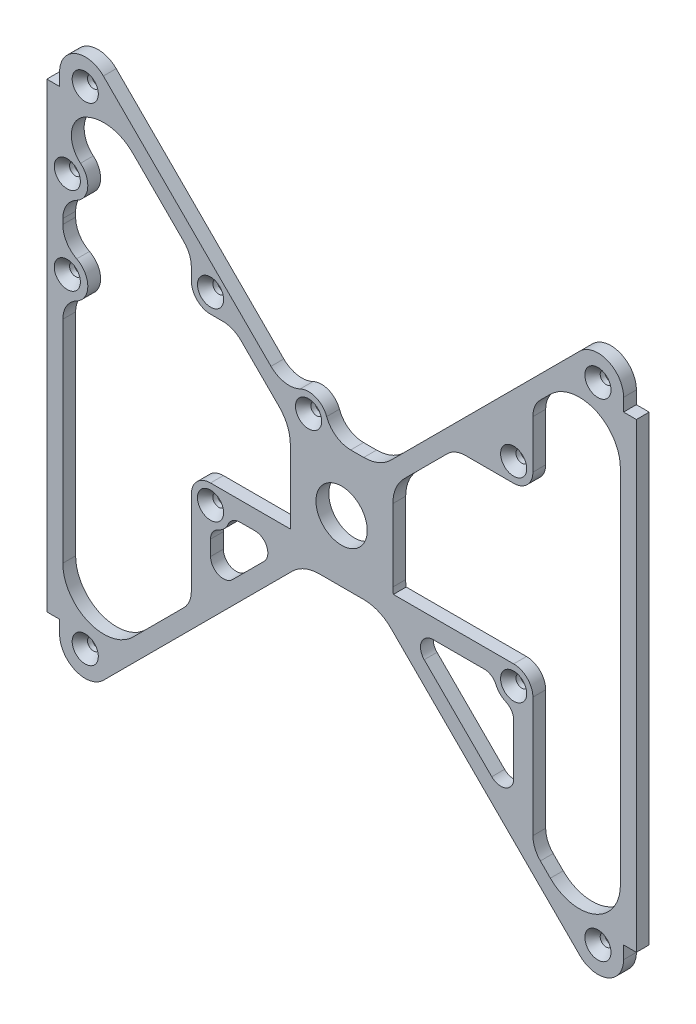
from build123d import *

# Parameters (mm, degrees)
BOSS_EXTRUDE1_DEPTH           = 3.175
MIRROR2_COPY_1_DEPTH          = 3.175
INTERNAL_SHARPS_R             = 9.525
IMU_MOUNTING_DEPTH            = 3.175
IMU_MOUNTING_HOLES_AT_2_COUNT = 2
IMU_MOUNTING_HOLES_AT_2_PITCH = 21.59
IMU_TOOLING_RADIUS_R          = 6.35
SKETCH18_R                    = 4.7625
MCU_MOUNTING_RIBS_DEPTH       = 3.175
TOOLING_RADIUS_R              = 6.35
TOOLING_RADIUS_SMALL_R        = 3.175
SKETCH6_R                     = 6.35
MATERIAL_REMOVAL_DEPTH        = 99.935771608
MCU_MOUNTING_HOLES_AT_2_COUNT = 2
MCU_MOUNTING_HOLES_AT_2_PITCH = 45.72
MCU_MOUNTING_HOLES_AT_3_COUNT = 2
MCU_MOUNTING_HOLES_AT_3_PITCH = 88.57441442
MCU_MOUNTING_HOLES_AT_4_COUNT = 2
MCU_MOUNTING_HOLES_AT_4_PITCH = 75.093140098
MCU_MOUNTING_HOLES_AT_5_COUNT = 2
MCU_MOUNTING_HOLES_AT_5_PITCH = 39.97120776


with BuildPart() as part:
    # Sketch1 → Boss-Extrude1 (new body)
    with BuildSketch(Plane.XY):
        with BuildLine():
            Line((9.434743879, 15.24), (0, 15.24))
            Line((0, 15.24), (0, 0))
            Line((0, 0), (12.7, 0))
            Line((12.7, 0), (12.7, 12.892596045))
            Line((12.7, 12.892596045), (51.712045103, 51.904641149))
            ThreePointArc((51.712045103, 51.904641149), (62.784313673, 54.107052302), (69.05625, 44.720436252))
            Line((69.05625, 44.720436252), (69.05625, 0))
            Line((69.05625, 0), (73.025, 0))
            Line((73.025, 0), (73.025, 57.15))
            Line((73.025, 57.15), (69.85, 57.15))
            Line((69.85, 57.15), (69.85, 60.325))
            ThreePointArc((69.85, 60.325), (65.930039796, 66.191635031), (59.009871939, 64.815128061))
            Line((59.009871939, 64.815128061), (9.434743879, 15.24))
        make_face()
    boss_extrude1 = extrude(amount=BOSS_EXTRUDE1_DEPTH)

    # Sketch11 → CSK for #4 Flat Head Machine Screw1 (revolve, cut)
    with BuildSketch(Plane(origin=(63.5, 60.325, 3.175), x_dir=(0, -1, 0), z_dir=(1, 0, 0))):
        Polygon((0, 0), (0, 3.175), (1.4732, 3.175), (1.4732, 2.030745349), (3.2385, 0), align=None)
    csk_for_4_flat_head_machine_screw1 = revolve(axis=Axis((63.5, 60.325, 9.525), (0, 0, -1)), mode=Mode.SUBTRACT)

    # Mirror1: Boss-Extrude1, CSK for #4 Flat Head Machine Screw1 across plane
    add(boss_extrude1.mirror(Plane.ZX))
    add(csk_for_4_flat_head_machine_screw1.mirror(Plane.ZX), mode=Mode.SUBTRACT)

    # Mirror2: Boss-Extrude1, CSK for #4 Flat Head Machine Screw1 across plane
    add(boss_extrude1.mirror(Plane(origin=(0, 0, 0), x_dir=(0, 0, 1), z_dir=(1, 0, 0))))
    add(csk_for_4_flat_head_machine_screw1.mirror(Plane(origin=(0, 0, 0), x_dir=(0, 0, 1), z_dir=(1, 0, 0))), mode=Mode.SUBTRACT)

    # Mirror2 copy 1 sketch → Mirror2 copy 1 (add)
    with BuildSketch(Plane(origin=(0, 0, 0), x_dir=(-1, 0, 0), z_dir=(0, 0, 1))):
        with BuildLine():
            Line((9.434743879, 15.24), (0, 15.24))
            Line((0, 15.24), (0, 0))
            Line((0, 0), (12.7, 0))
            Line((12.7, 0), (12.7, 12.892596045))
            Line((12.7, 12.892596045), (51.712045103, 51.904641149))
            ThreePointArc((51.712045103, 51.904641149), (62.784313673, 54.107052302), (69.05625, 44.720436252))
            Line((69.05625, 44.720436252), (69.05625, 0))
            Line((69.05625, 0), (73.025, 0))
            Line((73.025, 0), (73.025, 57.15))
            Line((73.025, 57.15), (69.85, 57.15))
            Line((69.85, 57.15), (69.85, 60.325))
            ThreePointArc((69.85, 60.325), (65.930039796, 66.191635031), (59.009871939, 64.815128061))
            Line((59.009871939, 64.815128061), (9.434743879, 15.24))
        make_face()
    extrude(amount=MIRROR2_COPY_1_DEPTH)

    # Mirror2 copy 2 sketch → Mirror2 copy 2 (revolve, cut)
    with BuildSketch(Plane(origin=(-63.5, -60.325, 3.175), x_dir=(0, 1, 0), z_dir=(-1, 0, 0))):
        Polygon((0, 0), (0, 3.175), (1.4732, 3.175), (1.4732, 2.030745349), (3.2385, 0), align=None)
    revolve(axis=Axis((-63.5, -60.325, 9.525), (0, 0, -1)), mode=Mode.SUBTRACT)

    # INTERNAL-SHARPS
    internal_sharps_edges = [part.edges().sort_by_distance(p)[0] for p in [
        (-9.434743879, 15.24, 1.5875),
        (-12.7, 12.892596045, 1.5875),
        (9.434743879, 15.24, 1.5875),
        (12.7, 12.892596045, 1.5875),
        (9.434743879, -15.24, 1.5875),
        (12.7, -12.892596045, 1.5875),
        (-12.7, -12.892596045, 1.5875),
        (-9.434743879, -15.24, 1.5875),
    ]]
    fillet(internal_sharps_edges, radius=INTERNAL_SHARPS_R)

    # Sketch13 → IMU-MOUNTING (add)
    with BuildSketch(Plane.XY):
        with BuildLine():
            Line((-73.025, 44.45), (-73.025, 12.7))
            Line((-73.025, 12.7), (-67.945, 12.7))
            ThreePointArc((-67.945, 12.7), (-62.895851895, 18.339020045), (-69.05625, 22.736967161))
            Line((-69.05625, 22.736967161), (-69.05625, 34.413032839))
            ThreePointArc((-69.05625, 34.413032839), (-62.895851895, 38.810979955), (-67.945, 44.45))
            Line((-67.945, 44.45), (-73.025, 44.45))
        make_face()
    extrude(amount=IMU_MOUNTING_DEPTH)

    # Sketch15 → IMU-MOUNTING-HOLES (revolve, cut)
    with BuildSketch(Plane(origin=(-67.945, 17.78, 3.175), x_dir=(0, -1, 0), z_dir=(1, 0, 0))):
        Polygon((0, 0), (0, 3.175), (1.4732, 3.175), (1.4732, 2.030745349), (3.2385, 0), align=None)
    imu_mounting_holes = revolve(axis=Axis((-67.945, 17.78, 9.525), (0, 0, -1)), mode=Mode.SUBTRACT)

    # IMU-MOUNTING-HOLES at 2: IMU-MOUNTING-HOLES ×2
    with Locations(*[(0, i * IMU_MOUNTING_HOLES_AT_2_PITCH, 0) for i in range(1, IMU_MOUNTING_HOLES_AT_2_COUNT)]):
        add(imu_mounting_holes, mode=Mode.SUBTRACT)

    # IMU-TOOLING-RADIUS
    imu_tooling_radius_edges = [part.edges().sort_by_distance(p)[0] for p in [
        (-69.05625, 44.45, 1.5875),
        (-69.05625, 12.7, 1.5875),
        (-69.05625, 22.736967161, 1.5875),
        (-69.05625, 34.413032839, 1.5875),
    ]]
    fillet(imu_tooling_radius_edges, radius=IMU_TOOLING_RADIUS_R)

    # Sketch18 → MCU-MOUNTING-RIBS (add)
    with BuildSketch(Plane(origin=(0, 0, 0), x_dir=(-1, 0, 0), z_dir=(0, 0, -1))):
        with Locations((8.1788, 17.78)):
            Circle(SKETCH18_R)
        with BuildLine():
            Line((32.4612, -32.653796045), (37.2237, -37.416296045))
            Line((37.2237, -37.416296045), (37.2237, -13.97))
            ThreePointArc((37.2237, -13.97), (35.828796045, -10.602403955), (32.4612, -9.2075))
            Line((32.4612, -9.2075), (9.014903955, -9.2075))
            Line((9.014903955, -9.2075), (13.777403955, -13.97))
            Line((13.777403955, -13.97), (27.6987, -13.97))
            ThreePointArc((27.6987, -13.97), (29.093603955, -17.337596045), (32.4612, -18.7325))
            Line((32.4612, -18.7325), (32.4612, -32.653796045))
        make_face()
        with BuildLine():
            Line((32.4612, 26.9875), (26.794903955, 26.9875))
            Line((26.794903955, 26.9875), (37.2237, 37.416296045))
            Line((37.2237, 37.416296045), (37.2237, 31.75))
            ThreePointArc((37.2237, 31.75), (35.828796045, 28.382403955), (32.4612, 26.9875))
        make_face()
        with BuildLine():
            Line((-42.6212, -10.4775), (-10.284903955, -10.4775))
            Line((-10.284903955, -10.4775), (-15.047403955, -15.24))
            Line((-15.047403955, -15.24), (-37.8587, -15.24))
            ThreePointArc((-37.8587, -15.24), (-39.253603955, -18.607596045), (-42.6212, -20.0025))
            Line((-42.6212, -20.0025), (-42.6212, -42.813796045))
            Line((-42.6212, -42.813796045), (-47.3837, -47.576296045))
            Line((-47.3837, -47.576296045), (-47.3837, -15.24))
            ThreePointArc((-47.3837, -15.24), (-45.988796045, -11.872403955), (-42.6212, -10.4775))
        make_face()
        with BuildLine():
            Line((-42.6212, 28.2575), (-28.064903955, 28.2575))
            Line((-28.064903955, 28.2575), (-47.3837, 47.576296045))
            Line((-47.3837, 47.576296045), (-47.3837, 33.02))
            ThreePointArc((-47.3837, 33.02), (-45.988796045, 29.652403955), (-42.6212, 28.2575))
        make_face()
    extrude(amount=-MCU_MOUNTING_RIBS_DEPTH)

    # TOOLING-RADIUS
    tooling_radius_edges = [part.edges().sort_by_distance(p)[0] for p in [
        (-37.2237, -37.416296045, 1.5875),
        (47.3837, -47.576296045, 1.5875),
        (-26.794903955, 26.9875, 1.5875),
        (-37.2237, 37.416296045, 1.5875),
        (28.064903955, 28.2575, 1.5875),
        (47.3837, 47.576296045, 1.5875),
        (-12.858570933, 18.663827054, 1.5875),
        (-4.150176631, 15.24, 1.5875),
    ]]
    fillet(tooling_radius_edges, radius=TOOLING_RADIUS_R)

    # TOOLING-RADIUS-SMALL
    # the kernel refuses this fillet: 3.175 mm, written as the material it adds along each edge
    with BuildSketch(Plane(origin=(42.6212, -20.0025, 0), x_dir=(-0.9789063129307034, 0.2043096436892193, 0), z_dir=(0, 0, 1)), Plane(origin=(-27.6987, -13.97, 0), x_dir=(-0.2043096436892193, -0.9789063129307034, 0), z_dir=(0, 0, 1))) as tooling_radius_small_piece_1:
        with BuildLine():
            CenterArc((2.594732475, 3.108027544), TOOLING_RADIUS_SMALL_R, 191.789089239, 66.421821522)
            Line((-0.513295069, 2.459344425), (0, 0))
            ThreePointArc((0, 0), (0.973024678, 0.100458685), (1.946049356, 0))
        make_face()
    extrude(amount=3.175)
    with BuildSketch(Plane(origin=(37.8587, -15.24, 0), x_dir=(-1, 0, 0), z_dir=(0, 0, 1)), Plane(origin=(-32.4612, -18.7325, 0), x_dir=(0, -1, 0), z_dir=(0, 0, 1))) as tooling_radius_small_piece_2:
        with BuildLine():
            CenterArc((2.512338916, 3.175), TOOLING_RADIUS_SMALL_R, 203.578178478, 66.421821522)
            ThreePointArc((-0.397596651, 1.905), (-0.100458685, 0.973024678), (0, 0))
            Line((0, 0), (2.512338916, 0))
        make_face()
    extrude(amount=3.175)
    with BuildSketch(Plane(origin=(42.6212, -42.813796045, 0), x_dir=(0, 1, 0), z_dir=(0, 0, 1))) as tooling_radius_small_piece_3:
        with BuildLine():
            CenterArc((TOOLING_RADIUS_SMALL_R * 2.41421356237, TOOLING_RADIUS_SMALL_R), TOOLING_RADIUS_SMALL_R, 135, 135)
            Line((TOOLING_RADIUS_SMALL_R * 1.70710678119, TOOLING_RADIUS_SMALL_R * 1.70710678119), (0, 0))
            Line((0, 0), (TOOLING_RADIUS_SMALL_R * 2.41421356237, 0))
        make_face()
    extrude(amount=3.175)
    with BuildSketch(Plane(origin=(-32.4612, -32.653796045, 0), x_dir=(0, 1, 0), z_dir=(0, 0, 1))) as tooling_radius_small_piece_4:
        with BuildLine():
            CenterArc((TOOLING_RADIUS_SMALL_R * 2.41421356237, -TOOLING_RADIUS_SMALL_R), TOOLING_RADIUS_SMALL_R, 90, 135)
            Line((TOOLING_RADIUS_SMALL_R * 1.70710678119, -TOOLING_RADIUS_SMALL_R * 1.70710678119), (0, 0))
            Line((0, 0), (TOOLING_RADIUS_SMALL_R * 2.41421356237, 0))
        make_face()
    extrude(amount=3.175)
    with BuildSketch(Plane(origin=(-14.131964455, -13.97, 0), x_dir=(-1, 0, 0), z_dir=(0, 0, 1))) as tooling_radius_small_piece_5:
        with BuildLine():
            CenterArc((7.310567561, 3.175), TOOLING_RADIUS_SMALL_R, 135, 135)
            Line((5.06550353, 5.42006403), (4.840997127, 5.644570433))
            ThreePointArc((4.840997127, 5.644570433), (1.133337052, 1.936910358), (-0.269767852, 0.167426271))
            Line((-0.269767852, 0.167426271), (0, -0.3175))
            Line((0, -0.3175), (7.310567561, -0.3175))
            Line((7.310567561, -0.3175), (7.310567561, 0))
        make_face()
    extrude(amount=3.175)
    with BuildSketch(Plane(origin=(15.074724308, -15.24, 0), x_dir=(0.7053179071572191, -0.7088911410388483, 0), z_dir=(0, 0, 1))) as tooling_radius_small_piece_6:
        with BuildLine():
            CenterArc((7.63781192, 3.174989865), TOOLING_RADIUS_SMALL_R, 135.144766988, 135)
            Line((5.387082547, 5.414374221), (5.16200961, 5.638312656))
            Line((5.16200961, 5.638312656), (-0.225072937, 0.223938436))
            Line((-0.225072937, 0.223938436), (-0.019410524, -0.316906108))
            ThreePointArc((-0.019410524, -0.316906108), (0.607184355, -0.33528533), (7.646636273, -0.317498987))
            Line((7.646636273, -0.317498987), (7.645834059, 0))
        make_face()
    extrude(amount=3.175)

    # Sketch6 → MATERIAL-REMOVAL (cut, through all)
    with BuildSketch(Plane(origin=(0, 0, 0), x_dir=(-1, 0, 0), z_dir=(0, 0, -1))):
        Circle(SKETCH6_R)
    extrude(amount=-MATERIAL_REMOVAL_DEPTH, mode=Mode.SUBTRACT)

    # Sketch20 → MCU-MOUNTING-HOLES (revolve, cut)
    with BuildSketch(Plane(origin=(-32.4612, -13.97, 3.175), x_dir=(0, -1, 0), z_dir=(1, 0, 0))):
        Polygon((0, 0), (0, 3.175), (1.4732, 3.175), (1.4732, 2.030745349), (3.2385, 0), align=None)
    mcu_mounting_holes = revolve(axis=Axis((-32.4612, -13.97, 9.525), (0, 0, -1)), mode=Mode.SUBTRACT)

    # MCU-MOUNTING-HOLES at 2: MCU-MOUNTING-HOLES ×2
    with Locations(*[(0, i * MCU_MOUNTING_HOLES_AT_2_PITCH, 0) for i in range(1, MCU_MOUNTING_HOLES_AT_2_COUNT)]):
        add(mcu_mounting_holes, mode=Mode.SUBTRACT)

    # MCU-MOUNTING-HOLES at 3: MCU-MOUNTING-HOLES ×2
    with Locations(*[Vector(0.8476759399659948, 0.5305143737946855, 0) * (i * MCU_MOUNTING_HOLES_AT_3_PITCH) for i in range(1, MCU_MOUNTING_HOLES_AT_3_COUNT)]):
        add(mcu_mounting_holes, mode=Mode.SUBTRACT)

    # MCU-MOUNTING-HOLES at 4: MCU-MOUNTING-HOLES ×2
    with Locations(*[Vector(0.9998569763114565, -0.016912330451817784, 0) * (i * MCU_MOUNTING_HOLES_AT_4_PITCH) for i in range(1, MCU_MOUNTING_HOLES_AT_4_COUNT)]):
        add(mcu_mounting_holes, mode=Mode.SUBTRACT)

    # MCU-MOUNTING-HOLES at 5: MCU-MOUNTING-HOLES ×2
    with Locations(*[Vector(0.6074972801935523, 0.7943217575752515, 0) * (i * MCU_MOUNTING_HOLES_AT_5_PITCH) for i in range(1, MCU_MOUNTING_HOLES_AT_5_COUNT)]):
        add(mcu_mounting_holes, mode=Mode.SUBTRACT)


solid = part.part
